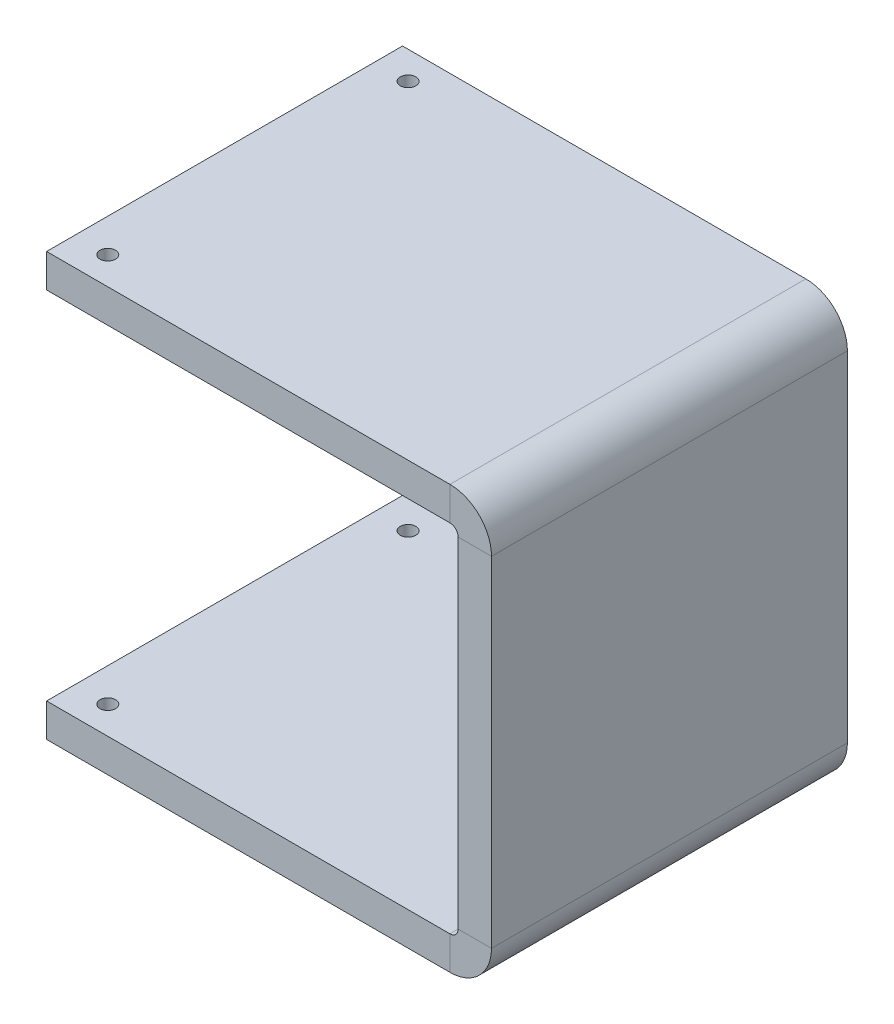
from build123d import *

# Parameters (mm, degrees)
T_LE_DE_BASE_PLI_E1_DEPTH = 32
ESQUISSE6_R               = 4.5
ENL_V_MAT_EXTRU_1_DEPTH   = 10
ESQUISSE7_R               = 0.7
ENL_V_MAT_EXTRU_2_DEPTH   = 64.780874876


# Sheet-metal steps are written as plain solids
with BuildPart() as part:
    # Esquisse1 → Tôle de base pliée1 (new body)
    with BuildSketch(Plane.XY):
        with BuildLine():
            Line((-40, 19), (-3.7366, 19))
            ThreePointArc((-3.7366, 19), (-1.094424801, 17.905575199), (0, 15.2634))
            Line((0, 15.2634), (0, -15.2634))
            ThreePointArc((0, -15.2634), (-1.094424801, -17.905575199), (-3.7366, -19))
            Line((-3.7366, -19), (-40, -19))
            Line((-40, -19), (-40, -16))
            Line((-40, -16), (-3.7366, -16))
            ThreePointArc((-3.7366, -16), (-3.215745145, -15.784254855), (-3, -15.2634))
            Line((-3, -15.2634), (-3, 15.2634))
            ThreePointArc((-3, 15.2634), (-3.215745145, 15.784254855), (-3.7366, 16))
            Line((-3.7366, 16), (-40, 16))
            Line((-40, 16), (-40, 19))
        make_face()
    extrude(amount=T_LE_DE_BASE_PLI_E1_DEPTH)

    # Esquisse6 → Enlèv. mat.-Extru.1 (cut)
    with BuildSketch(Plane.XZ.offset(19)):
        with Locations((-10.7366, 16)):
            Circle(ESQUISSE6_R)
    extrude(amount=-ENL_V_MAT_EXTRU_1_DEPTH, mode=Mode.SUBTRACT)

    # Esquisse7 → Enlèv. mat.-Extru.2 (cut, through all)
    with BuildSketch(Plane(origin=(0, 19, 0), x_dir=(1, 0, 0), z_dir=(0, 1, 0))):
        with Locations(Location((-37, -29.5, 0), (0, 0, 270))):
            Circle(ESQUISSE7_R)
        with Locations(Location((-37, -2.5, 0), (0, 0, 270))):
            Circle(ESQUISSE7_R)
    extrude(amount=-ENL_V_MAT_EXTRU_2_DEPTH, mode=Mode.SUBTRACT)


solid = part.part
